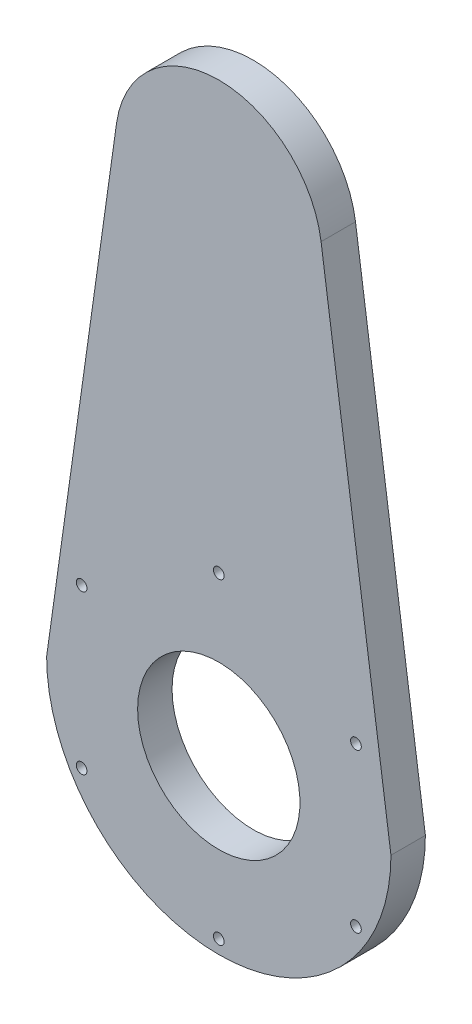
from build123d import *

# Parameters (mm, degrees)
AUFSATZ_LINEAR_AUSTRAGEN1_DEPTH  = 10
SKIZZE2_R                        = 23.575
SCHNITT_LINEAR_AUSTRAGEN1_DEPTH  = 10
F_3_1_3_1_DURCHMESSER_BOHRUNG1_D = 3.1


with BuildPart() as part:
    # Skizze1 → Aufsatz-Linear austragen1 (new body)
    with BuildSketch(Plane.XY):
        with BuildLine():
            Line((-50, 0), (-29.707205009, 144.181144646))
            ThreePointArc((-29.707205009, 144.181144646), (0, 170), (29.707205009, 144.181144646))
            Line((29.707205009, 144.181144646), (50, 0))
            ThreePointArc((50, 0), (0, -50), (-50, 0))
        make_face()
    extrude(amount=AUFSATZ_LINEAR_AUSTRAGEN1_DEPTH)

    # Skizze2 → Schnitt-Linear austragen1 (cut)
    with BuildSketch(Plane(origin=(0, 0, 0), x_dir=(-1, 0, 0), z_dir=(0, 0, -1))):
        Circle(SKIZZE2_R)
    extrude(amount=-SCHNITT_LINEAR_AUSTRAGEN1_DEPTH, mode=Mode.SUBTRACT)

    # Ø3.1 (3.1) Durchmesser Bohrung1 (through all)
    with Locations(Plane(origin=(0, 0, 0), x_dir=(-1, 0, 0), z_dir=(0, 0, -1))):
        with Locations((-39.837168574, 23), (0, 46), (39.837168574, 23), (39.837168574, -23), (0, -46), (-39.837168574, -23)):
            Hole(F_3_1_3_1_DURCHMESSER_BOHRUNG1_D / 2)


solid = part.part
